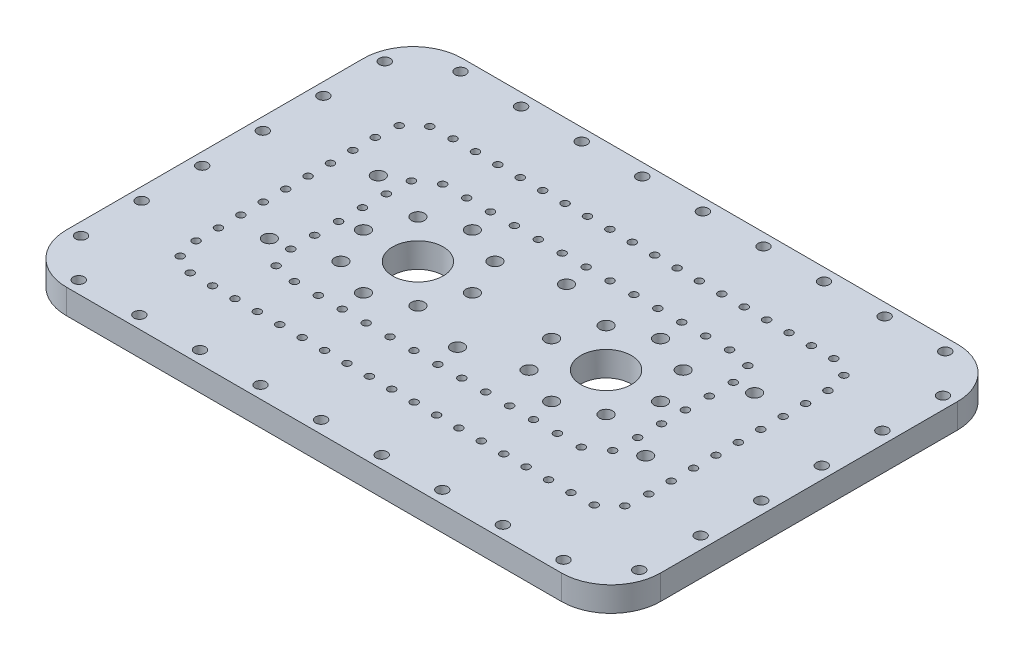
from build123d import *

# Parameters (mm, degrees)
SKETCH1_W                                        = 120
SKETCH1_H                                        = 80
BOSS_EXTRUDE1_DEPTH                              = 7
SKETCH2_W                                        = 110
SKETCH2_H                                        = 70
CUT_EXTRUDE1_DEPTH                               = 1.5
F_2_6_2_6_DIAMETER_HOLE1_D                       = 2.6
F_10_2_10_2_DIAMETER_HOLE1_D                     = 10.2
CBORE_FOR_M2_HEX_HEAD_MACHINE_SCREW1_D           = 2.6
CBORE_FOR_M2_HEX_HEAD_MACHINE_SCREW1_CBORE_D     = 5
CBORE_FOR_M2_HEX_HEAD_MACHINE_SCREW1_CBORE_DEPTH = 2.5
FILLET1_R                                        = 10
FILLET3_R                                        = 5
F_2_5MM_DOWEL_HOLE1_D                            = 2.2
CRVPATTERN1_OUTLINE_R                            = 1.1
CRVPATTERN1_DEPTH                                = 7
F_1_5MM_DOWEL_HOLE2_D                            = 1.5
CRVPATTERN3_OUTLINE_R                            = 0.75
CRVPATTERN3_DEPTH                                = 5.5
F_1_5MM_DOWEL_HOLE3_D                            = 1.5
CRVPATTERN4_OUTLINE_R                            = 0.75
CRVPATTERN4_DEPTH                                = 5.5
BOSS_EXTRUDE2_DEPTH                              = 1.45
SKETCH25_W                                       = 124.65453068
SKETCH25_H                                       = 86.700016861
CUT_EXTRUDE7_DEPTH                               = 2


# Read off the part's stored shape, not the designer's step: CrvPattern1, CrvPattern3, CrvPattern4
with BuildPart() as part:
    # Sketch1 → Boss-Extrude1 (new body)
    with BuildSketch(Plane(origin=(0, 7, 0), x_dir=(1, 0, 0), z_dir=(0, 1, 0))):
        Rectangle(SKETCH1_W, SKETCH1_H)
    extrude(amount=-BOSS_EXTRUDE1_DEPTH)

    # Sketch2 → Cut-Extrude1 (cut)
    with BuildSketch(Plane(origin=(0, 7, 0), x_dir=(-1, 0, 0), z_dir=(0, 1, 0))):
        Rectangle(SKETCH2_W, SKETCH2_H)
    extrude(amount=-CUT_EXTRUDE1_DEPTH, mode=Mode.SUBTRACT)

    # Ø2.6 (2.6) Diameter Hole1 (through all)
    with Locations(Plane(origin=(0, 5.5, 0), x_dir=(1, 0, 0), z_dir=(0, 1, 0))):
        with Locations((-38, -11), (0, 11), (-11.221825407, -7.778174593), (-19, -11), (-26.778174593, -7.778174593), (-26.778174593, 7.778174593), (-19, 11), (-11.221825407, 7.778174593), (11.221825407, 7.778174593), (19, 11), (26.778174593, 7.778174593), (30, 0), (26.778174593, -7.778174593), (19, -11), (11.221825407, -7.778174593), (-8, 0)):
            Hole(F_2_6_2_6_DIAMETER_HOLE1_D / 2)

    # Ø10.2 (10.2) Diameter Hole1 (through all)
    with Locations(Plane(origin=(0, 5.5, 0), x_dir=(1, 0, 0), z_dir=(0, 1, 0))):
        with Locations((19, 0), (-19, 0)):
            Hole(F_10_2_10_2_DIAMETER_HOLE1_D / 2)

    # CBORE for M2 Hex Head Machine Screw1 (through all)
    with Locations(Plane(origin=(0, 0, 0), x_dir=(-1, 0, 0), z_dir=(0, -1, 0))):
        with Locations((-8, 0), (30, 0), (38, 11), (-38, 11), (0, -11), (-38, -11), (26.778174593, -7.778174593), (38, -11), (19, -11), (11.221825407, -7.778174593), (8, 0), (11.221825407, 7.778174593), (19, 11), (26.778174593, 7.778174593), (0, 11), (-11.221825407, 7.778174593), (-19, 11), (-26.778174593, 7.778174593), (-30, 0), (-26.778174593, -7.778174593), (-19, -11), (-11.221825407, -7.778174593)):
            CounterBoreHole(CBORE_FOR_M2_HEX_HEAD_MACHINE_SCREW1_D / 2, CBORE_FOR_M2_HEX_HEAD_MACHINE_SCREW1_CBORE_D / 2, CBORE_FOR_M2_HEX_HEAD_MACHINE_SCREW1_CBORE_DEPTH)

    # Fillet1
    fillet1_edges = [part.edges().sort_by_distance(p)[0] for p in [
        (-60, 3.5, -40),
        (60, 3.5, -40),
        (60, 3.5, 40),
        (-60, 3.5, 40),
    ]]
    fillet(fillet1_edges, radius=FILLET1_R)

    # Fillet3
    fillet3_edges = [part.edges().sort_by_distance(p)[0] for p in [
        (-55, 6.25, 35),
        (-55, 6.25, -35),
        (55, 6.25, -35),
        (55, 6.25, 35),
    ]]
    fillet(fillet3_edges, radius=FILLET3_R)

    # Ø2.5mm Dowel Hole1 (through all)
    with Locations(Plane(origin=(0, 7, 0), x_dir=(1, 0, 0), z_dir=(0, 1, 0))):
        with Locations((50, 37.5)):
            Hole(F_2_5MM_DOWEL_HOLE1_D / 2)

    # CrvPattern1 outline → CrvPattern1 (cut)
    with BuildSketch(Plane(origin=(0, 0, 0), x_dir=(1, 0, 0), z_dir=(0, 1, 0))):
        with Locations((37.762537007, 37.5)):
            Circle(CRVPATTERN1_OUTLINE_R)
        with Locations((25.525074013, 37.5)):
            Circle(CRVPATTERN1_OUTLINE_R)
        with Locations((13.28761102, 37.5)):
            Circle(CRVPATTERN1_OUTLINE_R)
        with Locations((1.050148026, 37.5)):
            Circle(CRVPATTERN1_OUTLINE_R)
        with Locations((-11.187314967, 37.5)):
            Circle(CRVPATTERN1_OUTLINE_R)
        with Locations((-23.424777961, 37.5)):
            Circle(CRVPATTERN1_OUTLINE_R)
        with Locations((-35.662240954, 37.5)):
            Circle(CRVPATTERN1_OUTLINE_R)
        with Locations((-47.899703948, 37.5)):
            Circle(CRVPATTERN1_OUTLINE_R)
        with Locations((-57.320580195, 31.630676428)):
            Circle(CRVPATTERN1_OUTLINE_R)
        with Locations((-57.5, 19.406342516)):
            Circle(CRVPATTERN1_OUTLINE_R)
        with Locations((-57.5, 7.168879523)):
            Circle(CRVPATTERN1_OUTLINE_R)
        with Locations((-57.5, -5.068583471)):
            Circle(CRVPATTERN1_OUTLINE_R)
        with Locations((-57.5, -17.306046464)):
            Circle(CRVPATTERN1_OUTLINE_R)
        with Locations((-57.5, -29.543509458)):
            Circle(CRVPATTERN1_OUTLINE_R)
        with Locations((-50, -37.5)):
            Circle(CRVPATTERN1_OUTLINE_R)
        with Locations((-37.762537007, -37.5)):
            Circle(CRVPATTERN1_OUTLINE_R)
        with Locations((-25.525074013, -37.5)):
            Circle(CRVPATTERN1_OUTLINE_R)
        with Locations((-13.28761102, -37.5)):
            Circle(CRVPATTERN1_OUTLINE_R)
        with Locations((-1.050148026, -37.5)):
            Circle(CRVPATTERN1_OUTLINE_R)
        with Locations((11.187314967, -37.5)):
            Circle(CRVPATTERN1_OUTLINE_R)
        with Locations((23.424777961, -37.5)):
            Circle(CRVPATTERN1_OUTLINE_R)
        with Locations((35.662240954, -37.5)):
            Circle(CRVPATTERN1_OUTLINE_R)
        with Locations((47.899703948, -37.5)):
            Circle(CRVPATTERN1_OUTLINE_R)
        with Locations((57.320580195, -31.630676428)):
            Circle(CRVPATTERN1_OUTLINE_R)
        with Locations((57.5, -19.406342516)):
            Circle(CRVPATTERN1_OUTLINE_R)
        with Locations((57.5, -7.168879523)):
            Circle(CRVPATTERN1_OUTLINE_R)
        with Locations((57.5, 5.068583471)):
            Circle(CRVPATTERN1_OUTLINE_R)
        with Locations((57.5, 17.306046464)):
            Circle(CRVPATTERN1_OUTLINE_R)
        with Locations((57.5, 29.543509458)):
            Circle(CRVPATTERN1_OUTLINE_R)
    extrude(amount=CRVPATTERN1_DEPTH, mode=Mode.SUBTRACT)

    # Ø1.5mm Dowel Hole2 (through all)
    with Locations(Plane(origin=(0, 5.5, 0), x_dir=(1, 0, 0), z_dir=(0, 1, 0))):
        with Locations((40, 25)):
            Hole(F_1_5MM_DOWEL_HOLE2_D / 2)

    # CrvPattern3 outline → CrvPattern3 (cut)
    with BuildSketch(Plane(origin=(0, 0, 0), x_dir=(1, 0, 0), z_dir=(0, 1, 0))):
        with Locations((35.476401224, 25)):
            Circle(CRVPATTERN3_OUTLINE_R)
        with Locations((30.952802449, 25)):
            Circle(CRVPATTERN3_OUTLINE_R)
        with Locations((26.429203673, 25)):
            Circle(CRVPATTERN3_OUTLINE_R)
        with Locations((21.905604898, 25)):
            Circle(CRVPATTERN3_OUTLINE_R)
        with Locations((17.382006122, 25)):
            Circle(CRVPATTERN3_OUTLINE_R)
        with Locations((12.858407346, 25)):
            Circle(CRVPATTERN3_OUTLINE_R)
        with Locations((8.334808571, 25)):
            Circle(CRVPATTERN3_OUTLINE_R)
        with Locations((3.811209795, 25)):
            Circle(CRVPATTERN3_OUTLINE_R)
        with Locations((-0.71238898, 25)):
            Circle(CRVPATTERN3_OUTLINE_R)
        with Locations((-5.235987756, 25)):
            Circle(CRVPATTERN3_OUTLINE_R)
        with Locations((-9.759586532, 25)):
            Circle(CRVPATTERN3_OUTLINE_R)
        with Locations((-14.283185307, 25)):
            Circle(CRVPATTERN3_OUTLINE_R)
        with Locations((-18.806784083, 25)):
            Circle(CRVPATTERN3_OUTLINE_R)
        with Locations((-23.330382858, 25)):
            Circle(CRVPATTERN3_OUTLINE_R)
        with Locations((-27.853981634, 25)):
            Circle(CRVPATTERN3_OUTLINE_R)
        with Locations((-32.37758041, 25)):
            Circle(CRVPATTERN3_OUTLINE_R)
        with Locations((-36.901179185, 25)):
            Circle(CRVPATTERN3_OUTLINE_R)
        with Locations((-41.405574173, 24.798370687)):
            Circle(CRVPATTERN3_OUTLINE_R)
        with Locations((-44.64124129, 21.859806251)):
            Circle(CRVPATTERN3_OUTLINE_R)
        with Locations((-45, 17.382006122)):
            Circle(CRVPATTERN3_OUTLINE_R)
        with Locations((-45, 12.858407346)):
            Circle(CRVPATTERN3_OUTLINE_R)
        with Locations((-45, 8.334808571)):
            Circle(CRVPATTERN3_OUTLINE_R)
        with Locations((-45, 3.811209795)):
            Circle(CRVPATTERN3_OUTLINE_R)
        with Locations((-45, -0.71238898)):
            Circle(CRVPATTERN3_OUTLINE_R)
        with Locations((-45, -5.235987756)):
            Circle(CRVPATTERN3_OUTLINE_R)
        with Locations((-45, -9.759586532)):
            Circle(CRVPATTERN3_OUTLINE_R)
        with Locations((-45, -14.283185307)):
            Circle(CRVPATTERN3_OUTLINE_R)
        with Locations((-45, -18.806784083)):
            Circle(CRVPATTERN3_OUTLINE_R)
        with Locations((-43.931260104, -23.089529736)):
            Circle(CRVPATTERN3_OUTLINE_R)
        with Locations((-40, -25)):
            Circle(CRVPATTERN3_OUTLINE_R)
        with Locations((-35.476401224, -25)):
            Circle(CRVPATTERN3_OUTLINE_R)
        with Locations((-30.952802449, -25)):
            Circle(CRVPATTERN3_OUTLINE_R)
        with Locations((-26.429203673, -25)):
            Circle(CRVPATTERN3_OUTLINE_R)
        with Locations((-21.905604898, -25)):
            Circle(CRVPATTERN3_OUTLINE_R)
        with Locations((-17.382006122, -25)):
            Circle(CRVPATTERN3_OUTLINE_R)
        with Locations((-12.858407346, -25)):
            Circle(CRVPATTERN3_OUTLINE_R)
        with Locations((-8.334808571, -25)):
            Circle(CRVPATTERN3_OUTLINE_R)
        with Locations((-3.811209795, -25)):
            Circle(CRVPATTERN3_OUTLINE_R)
        with Locations((0.71238898, -25)):
            Circle(CRVPATTERN3_OUTLINE_R)
        with Locations((5.235987756, -25)):
            Circle(CRVPATTERN3_OUTLINE_R)
        with Locations((9.759586532, -25)):
            Circle(CRVPATTERN3_OUTLINE_R)
        with Locations((14.283185307, -25)):
            Circle(CRVPATTERN3_OUTLINE_R)
        with Locations((18.806784083, -25)):
            Circle(CRVPATTERN3_OUTLINE_R)
        with Locations((23.330382858, -25)):
            Circle(CRVPATTERN3_OUTLINE_R)
        with Locations((27.853981634, -25)):
            Circle(CRVPATTERN3_OUTLINE_R)
        with Locations((32.37758041, -25)):
            Circle(CRVPATTERN3_OUTLINE_R)
        with Locations((36.901179185, -25)):
            Circle(CRVPATTERN3_OUTLINE_R)
        with Locations((41.405574173, -24.798370687)):
            Circle(CRVPATTERN3_OUTLINE_R)
        with Locations((44.64124129, -21.859806251)):
            Circle(CRVPATTERN3_OUTLINE_R)
        with Locations((45, -17.382006122)):
            Circle(CRVPATTERN3_OUTLINE_R)
        with Locations((45, -12.858407346)):
            Circle(CRVPATTERN3_OUTLINE_R)
        with Locations((45, -8.334808571)):
            Circle(CRVPATTERN3_OUTLINE_R)
        with Locations((45, -3.811209795)):
            Circle(CRVPATTERN3_OUTLINE_R)
        with Locations((45, 0.71238898)):
            Circle(CRVPATTERN3_OUTLINE_R)
        with Locations((45, 5.235987756)):
            Circle(CRVPATTERN3_OUTLINE_R)
        with Locations((45, 9.759586532)):
            Circle(CRVPATTERN3_OUTLINE_R)
        with Locations((45, 14.283185307)):
            Circle(CRVPATTERN3_OUTLINE_R)
        with Locations((45, 18.806784083)):
            Circle(CRVPATTERN3_OUTLINE_R)
        with Locations((43.931260104, 23.089529736)):
            Circle(CRVPATTERN3_OUTLINE_R)
    extrude(amount=CRVPATTERN3_DEPTH, mode=Mode.SUBTRACT)

    # Ø1.5mm Dowel Hole3 (through all)
    with Locations(Plane(origin=(0, 0, 0), x_dir=(-1, 0, 0), z_dir=(0, -1, 0))):
        with Locations((-30, -16)):
            Hole(F_1_5MM_DOWEL_HOLE3_D / 2)

    # CrvPattern4 outline → CrvPattern4 (cut)
    with BuildSketch(Plane(origin=(0, 0, 0), x_dir=(1, 0, 0), z_dir=(0, 1, 0))):
        with Locations((25.171681469, -16)):
            Circle(CRVPATTERN4_OUTLINE_R)
        with Locations((20.343362939, -16)):
            Circle(CRVPATTERN4_OUTLINE_R)
        with Locations((15.515044408, -16)):
            Circle(CRVPATTERN4_OUTLINE_R)
        with Locations((10.686725877, -16)):
            Circle(CRVPATTERN4_OUTLINE_R)
        with Locations((5.858407346, -16)):
            Circle(CRVPATTERN4_OUTLINE_R)
        with Locations((1.030088816, -16)):
            Circle(CRVPATTERN4_OUTLINE_R)
        with Locations((-3.798229715, -16)):
            Circle(CRVPATTERN4_OUTLINE_R)
        with Locations((-8.626548246, -16)):
            Circle(CRVPATTERN4_OUTLINE_R)
        with Locations((-13.454866776, -16)):
            Circle(CRVPATTERN4_OUTLINE_R)
        with Locations((-18.283185307, -16)):
            Circle(CRVPATTERN4_OUTLINE_R)
        with Locations((-23.111503838, -16)):
            Circle(CRVPATTERN4_OUTLINE_R)
        with Locations((-27.939822369, -16)):
            Circle(CRVPATTERN4_OUTLINE_R)
        with Locations((-32.552422087, -15.079795689)):
            Circle(CRVPATTERN4_OUTLINE_R)
        with Locations((-34, -10.686725877)):
            Circle(CRVPATTERN4_OUTLINE_R)
        with Locations((-34, -5.858407346)):
            Circle(CRVPATTERN4_OUTLINE_R)
        with Locations((-34, -1.030088816)):
            Circle(CRVPATTERN4_OUTLINE_R)
        with Locations((-34, 3.798229715)):
            Circle(CRVPATTERN4_OUTLINE_R)
        with Locations((-34, 8.626548246)):
            Circle(CRVPATTERN4_OUTLINE_R)
        with Locations((-33.738324268, 13.423000937)):
            Circle(CRVPATTERN4_OUTLINE_R)
        with Locations((-30, 16)):
            Circle(CRVPATTERN4_OUTLINE_R)
        with Locations((-25.171681469, 16)):
            Circle(CRVPATTERN4_OUTLINE_R)
        with Locations((-20.343362939, 16)):
            Circle(CRVPATTERN4_OUTLINE_R)
        with Locations((-15.515044408, 16)):
            Circle(CRVPATTERN4_OUTLINE_R)
        with Locations((-10.686725877, 16)):
            Circle(CRVPATTERN4_OUTLINE_R)
        with Locations((-5.858407346, 16)):
            Circle(CRVPATTERN4_OUTLINE_R)
        with Locations((-1.030088816, 16)):
            Circle(CRVPATTERN4_OUTLINE_R)
        with Locations((3.798229715, 16)):
            Circle(CRVPATTERN4_OUTLINE_R)
        with Locations((8.626548246, 16)):
            Circle(CRVPATTERN4_OUTLINE_R)
        with Locations((13.454866776, 16)):
            Circle(CRVPATTERN4_OUTLINE_R)
        with Locations((18.283185307, 16)):
            Circle(CRVPATTERN4_OUTLINE_R)
        with Locations((23.111503838, 16)):
            Circle(CRVPATTERN4_OUTLINE_R)
        with Locations((27.939822369, 16)):
            Circle(CRVPATTERN4_OUTLINE_R)
        with Locations((32.552422087, 15.079795689)):
            Circle(CRVPATTERN4_OUTLINE_R)
        with Locations((34, 10.686725877)):
            Circle(CRVPATTERN4_OUTLINE_R)
        with Locations((34, 5.858407346)):
            Circle(CRVPATTERN4_OUTLINE_R)
        with Locations((34, 1.030088816)):
            Circle(CRVPATTERN4_OUTLINE_R)
        with Locations((34, -3.798229715)):
            Circle(CRVPATTERN4_OUTLINE_R)
        with Locations((34, -8.626548246)):
            Circle(CRVPATTERN4_OUTLINE_R)
        with Locations((33.738324268, -13.423000937)):
            Circle(CRVPATTERN4_OUTLINE_R)
    extrude(amount=CRVPATTERN4_DEPTH, mode=Mode.SUBTRACT)

    # Sketch23 → Boss-Extrude2 (add)
    with BuildSketch(Plane(origin=(0, 5.5, 0), x_dir=(1, 0, 0), z_dir=(0, 1, 0))):
        with BuildLine():
            ThreePointArc((52.5, -30), (51.767766953, -28.232233047), (50, -27.5))
            Line((50, -27.5), (50, -32.5))
            ThreePointArc((50, -32.5), (51.767766953, -31.767766953), (52.5, -30))
        make_face()
        with BuildLine():
            Line((50, -32.5), (50, -27.5))
            ThreePointArc((50, -27.5), (47.5, -30), (50, -32.5))
        make_face()
        with BuildLine():
            ThreePointArc((50, -32.5), (47.5, -30), (50, -27.5))
            Line((50, -27.5), (46, -27.5))
            Line((46, -27.5), (46, -32.5))
            Line((46, -32.5), (50, -32.5))
        make_face()
        with BuildLine():
            Line((46, -2.5), (50, -2.5))
            ThreePointArc((50, -2.5), (47.5, 0), (50, 2.5))
            Line((50, 2.5), (46, 2.5))
            Line((46, 2.5), (46, -2.5))
        make_face()
        with BuildLine():
            ThreePointArc((50, 2.5), (47.5, 0), (50, -2.5))
            Line((50, -2.5), (50, 2.5))
        make_face()
        with BuildLine():
            Line((50, 2.5), (50, -2.5))
            ThreePointArc((50, -2.5), (51.767766953, -1.767766953), (52.5, 0))
            ThreePointArc((52.5, 0), (51.767766953, 1.767766953), (50, 2.5))
        make_face()
        with BuildLine():
            Line((46, 27.5), (50, 27.5))
            ThreePointArc((50, 27.5), (47.5, 30), (50, 32.5))
            Line((50, 32.5), (46, 32.5))
            Line((46, 32.5), (46, 27.5))
        make_face()
        with BuildLine():
            ThreePointArc((50, 32.5), (47.5, 30), (50, 27.5))
            Line((50, 27.5), (50, 32.5))
        make_face()
        with BuildLine():
            Line((50, 32.5), (50, 27.5))
            ThreePointArc((50, 27.5), (51.767766953, 28.232233047), (52.5, 30))
            ThreePointArc((52.5, 30), (51.767766953, 31.767766953), (50, 32.5))
        make_face()
        with BuildLine():
            ThreePointArc((2.5, 30), (0, 27.5), (-2.5, 30))
            Line((-2.5, 30), (-2.5, 26))
            Line((-2.5, 26), (2.5, 26))
            Line((2.5, 26), (2.5, 30))
        make_face()
        with BuildLine():
            ThreePointArc((2.5, 30), (0, 32.5), (-2.5, 30))
            Line((-2.5, 30), (2.5, 30))
        make_face()
        with BuildLine():
            Line((2.5, 30), (-2.5, 30))
            ThreePointArc((-2.5, 30), (0, 27.5), (2.5, 30))
        make_face()
        with BuildLine():
            ThreePointArc((-2.5, -30), (0, -27.5), (2.5, -30))
            Line((2.5, -30), (2.5, -26))
            Line((2.5, -26), (-2.5, -26))
            Line((-2.5, -26), (-2.5, -30))
        make_face()
        with BuildLine():
            ThreePointArc((-2.5, -30), (0, -32.5), (2.5, -30))
            Line((2.5, -30), (-2.5, -30))
        make_face()
        with BuildLine():
            Line((-2.5, -30), (2.5, -30))
            ThreePointArc((2.5, -30), (0, -27.5), (-2.5, -30))
        make_face()
        with BuildLine():
            ThreePointArc((-50, -27.5), (-52.5, -30), (-50, -32.5))
            Line((-50, -32.5), (-50, -27.5))
        make_face()
        with BuildLine():
            Line((-50, -27.5), (-50, -32.5))
            ThreePointArc((-50, -32.5), (-48.232233047, -31.767766953), (-47.5, -30))
            ThreePointArc((-47.5, -30), (-48.232233047, -28.232233047), (-50, -27.5))
        make_face()
        with BuildLine():
            ThreePointArc((-47.5, -30), (-48.232233047, -31.767766953), (-50, -32.5))
            Line((-50, -32.5), (-46, -32.5))
            Line((-46, -32.5), (-46, -27.5))
            Line((-46, -27.5), (-50, -27.5))
            ThreePointArc((-50, -27.5), (-48.232233047, -28.232233047), (-47.5, -30))
        make_face()
        with BuildLine():
            ThreePointArc((-50, 32.5), (-52.5, 30), (-50, 27.5))
            Line((-50, 27.5), (-50, 32.5))
        make_face()
        with BuildLine():
            Line((-50, 32.5), (-50, 27.5))
            ThreePointArc((-50, 27.5), (-48.232233047, 28.232233047), (-47.5, 30))
            ThreePointArc((-47.5, 30), (-48.232233047, 31.767766953), (-50, 32.5))
        make_face()
        with BuildLine():
            ThreePointArc((-47.5, 30), (-48.232233047, 28.232233047), (-50, 27.5))
            Line((-50, 27.5), (-46, 27.5))
            Line((-46, 27.5), (-46, 32.5))
            Line((-46, 32.5), (-50, 32.5))
            ThreePointArc((-50, 32.5), (-48.232233047, 31.767766953), (-47.5, 30))
        make_face()
        with BuildLine():
            ThreePointArc((-50, 2.5), (-52.5, 0), (-50, -2.5))
            Line((-50, -2.5), (-50, 2.5))
        make_face()
        with BuildLine():
            Line((-50, 2.5), (-50, -2.5))
            ThreePointArc((-50, -2.5), (-48.232233047, -1.767766953), (-47.5, 0))
            ThreePointArc((-47.5, 0), (-48.232233047, 1.767766953), (-50, 2.5))
        make_face()
        with BuildLine():
            ThreePointArc((-47.5, 0), (-48.232233047, -1.767766953), (-50, -2.5))
            Line((-50, -2.5), (-46, -2.5))
            Line((-46, -2.5), (-46, 2.5))
            Line((-46, 2.5), (-50, 2.5))
            ThreePointArc((-50, 2.5), (-48.232233047, 1.767766953), (-47.5, 0))
        make_face()
    extrude(amount=BOSS_EXTRUDE2_DEPTH)

    # Sketch25 → Cut-Extrude7 (cut)
    with BuildSketch(Plane(origin=(0, 7, 0), x_dir=(1, 0, 0), z_dir=(0, 1, 0))):
        with Locations((-0.186051538, 0.248068718)):
            Rectangle(SKETCH25_W, SKETCH25_H)
    extrude(amount=-CUT_EXTRUDE7_DEPTH, mode=Mode.SUBTRACT)


solid = part.part
